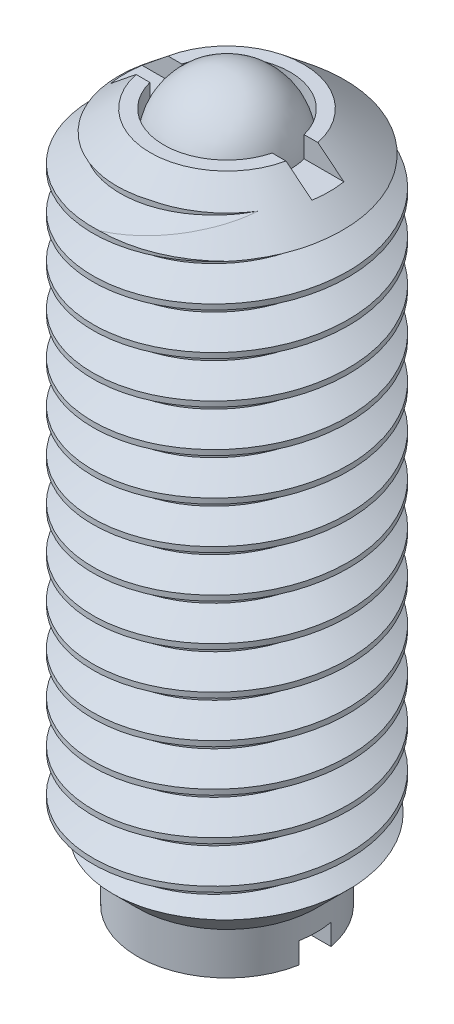
from build123d import *

# Parameters (mm, degrees)
SKETCH24_W               = 2.413
SKETCH24_H               = 13.0302
CUT_SWEEP1_PITCH         = 0.79375
SKETCH26_W               = 1.1938
SKETCH26_H               = 11.72718
CUT_EXTRUDE11_DEPTH      = 8.354703921
CUT_EXTRUDE11_DEPTH_BACK = 8.354703921
SKETCH28_W               = 0.60325
SKETCH28_H               = 0.396875


with BuildPart() as part:
    # Sketch24 → Revolve1 (revolve)
    with BuildSketch(Plane(origin=(0, 0, 0), x_dir=(0, 0, -1), z_dir=(1, 0, 0)), mode=Mode.PRIVATE) as revolve1_sk:
        with Locations((1.2065, 0)):
            Rectangle(SKETCH24_W, SKETCH24_H)
    revolve(revolve1_sk.sketch.rotate(Axis((0, 6.5151, 0), (0, -1, 0)), 180), axis=Axis((0, 6.5151, 0), (0, -1, 0)))

    # Cut-Sweep1: the profile of Sketch38 profile screwed along a right-hand helix of 17.416 turns, 8 arcs to a turn; built about Z, then put on its axis
    cut_sweep1_z = Axis((0, 0, 0), (0, 0, 1))
    cut_sweep1_corners = [(2.4133, 0, -0.694704455), (2.4133, 0, 0.000173205), (1.897444252, 0, -0.29765625), (1.897444252, 0, -0.396875)]
    with BuildLine(mode=Mode.PRIVATE) as cut_sweep1_profile:
        Line(cut_sweep1_corners[0], cut_sweep1_corners[1])
        Line(cut_sweep1_corners[1], cut_sweep1_corners[2])
        Line(cut_sweep1_corners[2], cut_sweep1_corners[3])
        Line(cut_sweep1_corners[3], cut_sweep1_corners[0])
    cut_sweep1_cap = Face(cut_sweep1_profile.wire())
    cut_sweep1_turn_angles = [0, 22.5, 45, 67.5, 90, 112.5, 135, 157.5, 180, 202.5, 225, 247.5, 270, 292.5, 315, 337.5, 360]
    cut_sweep1_turn_weights = [1, 0.9238795325112867, 1, 0.9238795325112867, 1, 0.9238795325112867, 1, 0.9238795325112867, 1, 0.9238795325112867, 1, 0.9238795325112867, 1, 0.9238795325112867, 1, 0.9238795325112867, 1]
    cut_sweep1_turn_rails = [Edge.make_bspline([Vector(p[0], p[1], 0).rotate(cut_sweep1_z, cut_sweep1_turn_angles[k]) / cut_sweep1_turn_weights[k] + Vector(0, 0, p[2] + CUT_SWEEP1_PITCH * cut_sweep1_turn_angles[k] / 360) for k in range(17)], [0, 0, 0, 1, 1, 2, 2, 3, 3, 4, 4, 5, 5, 6, 6, 7, 7, 8, 8, 8], 2, cut_sweep1_turn_weights) for p in cut_sweep1_corners]
    cut_sweep1_turn_sides = [Face.make_surface_from_curves(cut_sweep1_turn_rails[p[0]], cut_sweep1_turn_rails[p[1]]) for p in [(0, 1), (1, 2), (2, 3), (3, 0)]]
    cut_sweep1_last_angles = [6120, 6142.5, 6165, 6187.5, 6210, 6232.5, 6255, 6262.38, 6269.76]
    cut_sweep1_last_weights = [1, 0.9238795325112867, 1, 0.9238795325112867, 1, 0.9238795325112867, 1, 0.9917160601105401, 1]
    cut_sweep1_last_rails = [Edge.make_bspline([Vector(p[0], p[1], 0).rotate(cut_sweep1_z, cut_sweep1_last_angles[k]) / cut_sweep1_last_weights[k] + Vector(0, 0, p[2] + CUT_SWEEP1_PITCH * cut_sweep1_last_angles[k] / 360) for k in range(9)], [0, 0, 0, 1, 1, 2, 2, 3, 3, 4, 4, 4], 2, cut_sweep1_last_weights) for p in cut_sweep1_corners]
    cut_sweep1_last_sides = [Face.make_surface_from_curves(cut_sweep1_last_rails[p[0]], cut_sweep1_last_rails[p[1]]) for p in [(0, 1), (1, 2), (2, 3), (3, 0)]]
    cut_sweep1 = Plane(origin=(0, 6.5151, 0), x_dir=(0, 0, 1), z_dir=(0, -1, 0)) * Solid(Shell([*[p.moved(Location((0, 0, CUT_SWEEP1_PITCH * i))) for i in range(17) for p in cut_sweep1_turn_sides], *cut_sweep1_last_sides, cut_sweep1_cap, cut_sweep1_cap.rotate(cut_sweep1_z, 6269.76).moved(Location((0, 0, CUT_SWEEP1_PITCH * 6269.76 / 360)))]))
    add(cut_sweep1, mode=Mode.SUBTRACT)

    # Sketch26 → Cut-Revolve10 (revolve, cut)
    with BuildSketch(Plane(origin=(0, 0, 0), x_dir=(0, 0, -1), z_dir=(1, 0, 0))):
        with Locations((0.5969, 0.65151)):
            Rectangle(SKETCH26_W, SKETCH26_H)
    revolve(axis=Axis((0, -5.21208, 0), (0, 1, 0)), mode=Mode.SUBTRACT)

    # Sketch31 → Cut-Revolve13 (revolve, cut)
    with BuildSketch(Plane(origin=(0, 0, 0), x_dir=(0, 0, -1), z_dir=(1, 0, 0)), mode=Mode.PRIVATE) as cut_revolve13_sk:
        Polygon((2.413, -6.5151), (1.6891, -6.5151), (1.6891, -5.72135), (2.413, -4.99745), align=None)
        Polygon((2.413, 6.5151), (1.4478, 6.5151), (2.413, 5.72135), align=None)
    revolve(cut_revolve13_sk.sketch.rotate(Axis((0, 6.5151, 0), (0, -1, 0)), 180), axis=Axis((0, 6.5151, 0), (0, -1, 0)), mode=Mode.SUBTRACT)

    # Sketch28 → Cut-Extrude11 (cut, two sides: drawn at the far end of the back side and taken through both)
    with BuildSketch(Plane(origin=(0, 0, 0), x_dir=(0, 0, -1), z_dir=(1, 0, 0)).offset(-CUT_EXTRUDE11_DEPTH_BACK)):
        with Locations((0, -6.3166625)):
            Rectangle(SKETCH28_W, SKETCH28_H)
        with Locations((0, 6.3166625)):
            Rectangle(SKETCH28_W, SKETCH28_H)
    extrude(amount=CUT_EXTRUDE11_DEPTH + CUT_EXTRUDE11_DEPTH_BACK, mode=Mode.SUBTRACT)


with BuildPart() as body_2:
    # Sketch27 → Revolve2 (revolve)
    with BuildSketch(Plane(origin=(0, 0, 0), x_dir=(0, 0, -1), z_dir=(1, 0, 0))):
        with BuildLine():
            Line((0, 7.1501), (0, 4.7625))
            ThreePointArc((0, 4.7625), (1.1938, 5.9563), (0, 7.1501))
        make_face()
    revolve(axis=Axis((0, 7.1501, 0), (0, -1, 0)))


solid = Compound([part.part, body_2.part])
